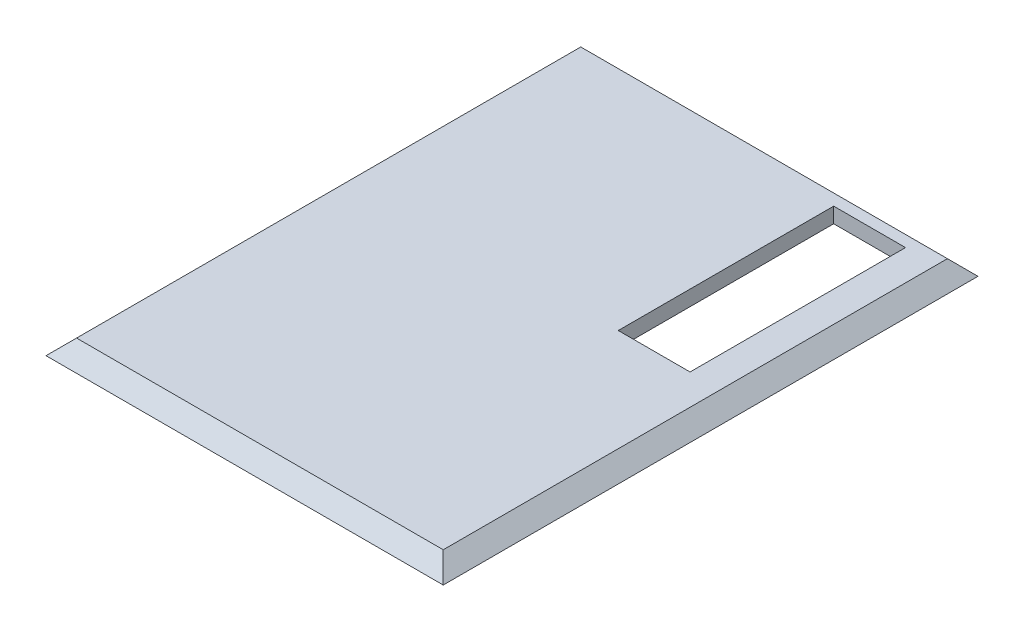
from build123d import *

# Parameters (mm, degrees)
SKETCH1_W           = 130
SKETCH1_H           = 175
BOSS_EXTRUDE1_DEPTH = 5
CHAMFER1_SIZE       = 5
SKETCH2_W           = 1.5
SKETCH2_H           = 5
BOSS_EXTRUDE2_DEPTH = 5
FILLET2_R           = 1
FILLET3_R           = 1
CUT_EXTRUDE1_DEPTH  = 5


# Some blends are built 0.0001 mm under size
with BuildPart() as part:
    # Sketch1 → Boss-Extrude1 (new body)
    with BuildSketch(Plane(origin=(0, 0, 0), x_dir=(1, 0, 0), z_dir=(0, 1, 0))):
        Rectangle(SKETCH1_W, SKETCH1_H)
    extrude(amount=BOSS_EXTRUDE1_DEPTH)

    # Chamfer1
    chamfer1_edges = [part.edges().sort_by_distance(p)[0] for p in [
        (65, 5, 0),
        (0, 5, -87.5),
        (-65, 5, 0),
        (0, 5, 87.5),
    ]]
    chamfer(chamfer1_edges, length=CHAMFER1_SIZE - 0.0001)  # a hair under: the kernel refuses the full size

    # Sketch2 → Boss-Extrude2 (add)
    with BuildSketch(Plane.XZ):
        Polygon((0, 5), (0, 0), (-1.5, 0), (-1.5, -5), (1.5, -5), (1.5, 5), align=None)
        with Locations((-0.75, 2.5)):
            Rectangle(SKETCH2_W, SKETCH2_H)
    extrude(amount=BOSS_EXTRUDE2_DEPTH)

    # Fillet2
    fillet2_edges = [part.edges().sort_by_distance(p)[0] for p in [
        (-1.5, -5, 0),
        (0, -5, -5),
        (0, -5, 5),
        (1.5, -5, 0),
    ]]
    fillet(fillet2_edges, radius=FILLET2_R)

    # Fillet3
    # the kernel refuses this fillet: 1 mm, written as the material it takes off along each edge
    with BuildSketch(Plane(origin=(-0.5, -4, -4), x_dir=(0, 0, -1), z_dir=(-1, 0, 0))) as fillet3_piece_1_section:
        Polygon((0, 0), (FILLET3_R, 0), (FILLET3_R, FILLET3_R), (0, FILLET3_R), align=None)
    fillet3_piece_1 = extrude(amount=FILLET3_R, mode=Mode.PRIVATE)
    fillet3_piece_1 = fillet3_piece_1 - Plane(origin=(-0.5, -4, -4), x_dir=(0, 0.7071067811865475, 0.7071067811865475), z_dir=(-1, 0, 0)) * Sphere(FILLET3_R, mode=Mode.PRIVATE)
    add(fillet3_piece_1, mode=Mode.SUBTRACT)
    with BuildSketch(Plane(origin=(-0.5, -4, 4), x_dir=(-1, 0, 0), z_dir=(0, 0, 1))) as fillet3_piece_2_section:
        Polygon((0, 0), (FILLET3_R, 0), (FILLET3_R, FILLET3_R), (0, FILLET3_R), align=None)
    fillet3_piece_2 = extrude(amount=FILLET3_R, mode=Mode.PRIVATE)
    fillet3_piece_2 = fillet3_piece_2 - Plane(origin=(-0.5, -4, 4), x_dir=(0.7071067811865475, 0.7071067811865475, 0), z_dir=(0, 0, 1)) * Sphere(FILLET3_R, mode=Mode.PRIVATE)
    add(fillet3_piece_2, mode=Mode.SUBTRACT)
    with BuildSketch(Plane(origin=(0.5, -4, -4), x_dir=(0, 0, -1), z_dir=(1, 0, 0))) as fillet3_piece_3_section:
        Polygon((0, 0), (FILLET3_R, 0), (FILLET3_R, -FILLET3_R), (0, -FILLET3_R), align=None)
    fillet3_piece_3 = extrude(amount=FILLET3_R, mode=Mode.PRIVATE)
    fillet3_piece_3 = fillet3_piece_3 - Plane(origin=(0.5, -4, -4), x_dir=(0, 0.7071067811865475, 0.7071067811865475), z_dir=(1, 0, 0)) * Sphere(FILLET3_R, mode=Mode.PRIVATE)
    add(fillet3_piece_3, mode=Mode.SUBTRACT)
    with BuildSketch(Plane(origin=(0.5, -4, 4), x_dir=(1, 0, 0), z_dir=(0, 0, 1))) as fillet3_piece_4_section:
        Polygon((0, 0), (FILLET3_R, 0), (FILLET3_R, -FILLET3_R), (0, -FILLET3_R), align=None)
    fillet3_piece_4 = extrude(amount=FILLET3_R, mode=Mode.PRIVATE)
    fillet3_piece_4 = fillet3_piece_4 - Plane(origin=(0.5, -4, 4), x_dir=(-0.7071067811865475, 0.7071067811865475, 0), z_dir=(0, 0, 1)) * Sphere(FILLET3_R, mode=Mode.PRIVATE)
    add(fillet3_piece_4, mode=Mode.SUBTRACT)
    with BuildSketch(Plane(origin=(1.5, 0, 5), x_dir=(-1, 0, 0), z_dir=(0, -1, 0)), Plane(origin=(1.5, 0, -5), x_dir=(0, 0, 1), z_dir=(0, -1, 0))) as fillet3_piece_5:
        with BuildLine():
            CenterArc((FILLET3_R, FILLET3_R), FILLET3_R, 180, 90)
            Line((0, FILLET3_R), (0, 0))
            Line((0, 0), (FILLET3_R, 0))
        make_face()
    extrude(amount=4, mode=Mode.SUBTRACT)
    with BuildSketch(Plane(origin=(-1.5, 0, -5), x_dir=(0, 0, 1), z_dir=(0, -1, 0)), Plane(origin=(-1.5, 0, 5), x_dir=(1, 0, 0), z_dir=(0, -1, 0))) as fillet3_piece_6:
        with BuildLine():
            CenterArc((FILLET3_R, -FILLET3_R), FILLET3_R, 90, 90)
            Line((0, -FILLET3_R), (0, 0))
            Line((0, 0), (FILLET3_R, 0))
        make_face()
    extrude(amount=4, mode=Mode.SUBTRACT)

    # Sketch4 → Cut-Extrude1 (cut)
    with BuildSketch(Plane.XZ):
        Polygon((50, -78.775), (26.5, -78.775), (26.5, -8.275), (50, -8.275), (50, -43.75), align=None)
    extrude(amount=-CUT_EXTRUDE1_DEPTH, mode=Mode.SUBTRACT)


solid = part.part
